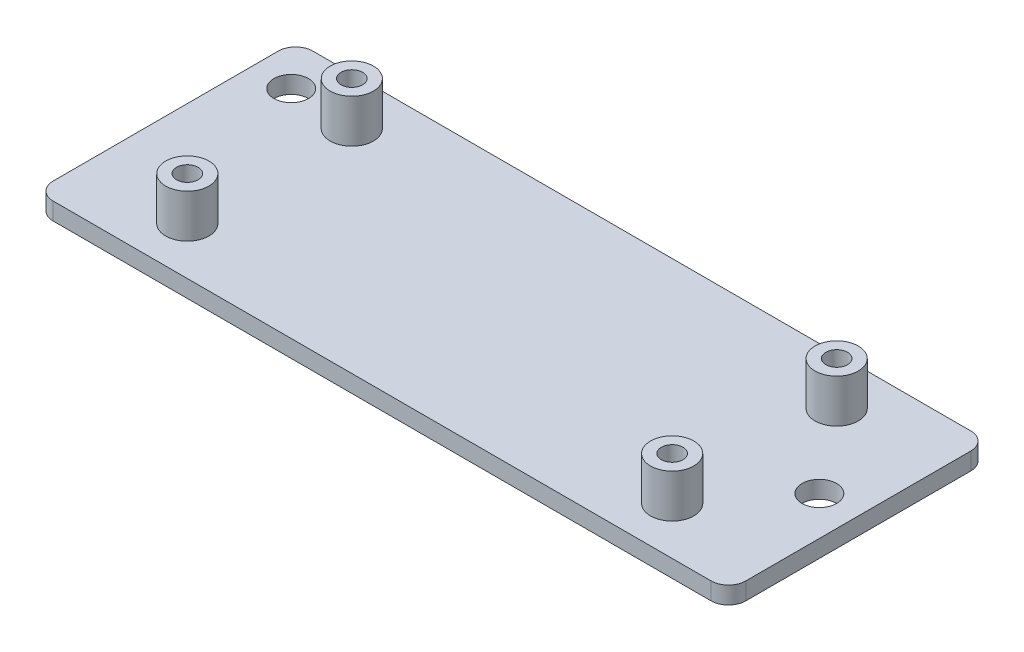
from build123d import *

# Parameters (mm, degrees)
SKETCH_1_W               = 80
SKETCH_1_H               = 30
EXTRUDE_1_DEPTH          = 2
SKETCH_2_R               = 2.5
EXTRUDE_2_DEPTH          = 5
CUT_EXTRUDE_1_DEPTH      = 86.726308681
CUT_EXTRUDE_1_DEPTH_BACK = 86.726308681
SKETCH_3_R               = 1.25
CUT_EXTRUDE_2_DEPTH      = 86.586213843
CUT_EXTRUDE_2_DEPTH_BACK = 86.586213843
SKETCH_4_R               = 2
FILLET_1_R               = 2
FILLET_2_R               = 2
FILLET_3_R               = 2
FILLET_4_R               = 2


with BuildPart() as part:
    # Эскиз1 → Бобышка-Вытянуть1 (new body)
    with BuildSketch(Plane(origin=(0, 0, 0), x_dir=(1, 0, 0), z_dir=(0, 1, 0))):
        with Locations((40, -15)):
            Rectangle(SKETCH_1_W, SKETCH_1_H)
    extrude(amount=EXTRUDE_1_DEPTH)

    # Эскиз2 → Бобышка-Вытянуть2 (add)
    with BuildSketch(Plane(origin=(0, 2, 0), x_dir=(1, 0, 0), z_dir=(0, 1, 0))):
        with Locations((12, -5.5)):
            Circle(SKETCH_2_R)
        with Locations((12, -24.5)):
            Circle(SKETCH_2_R)
        with Locations((68, -5.5)):
            Circle(SKETCH_2_R)
        with Locations((68, -24.5)):
            Circle(SKETCH_2_R)
    extrude(amount=EXTRUDE_2_DEPTH)

    # Эскиз3 → Вырез-Вытянуть1 (cut, two sides: drawn at the far end of the back side and taken through both)
    with BuildSketch(Plane(origin=(0, 7, 0), x_dir=(1, 0, 0), z_dir=(0, 1, 0)).offset(-CUT_EXTRUDE_1_DEPTH_BACK)):
        with Locations((12, -5.5)):
            Circle(SKETCH_3_R)
        with Locations((12, -24.5)):
            Circle(SKETCH_3_R)
        with Locations((68, -5.5)):
            Circle(SKETCH_3_R)
        with Locations((68, -24.5)):
            Circle(SKETCH_3_R)
    extrude(amount=CUT_EXTRUDE_1_DEPTH + CUT_EXTRUDE_1_DEPTH_BACK, mode=Mode.SUBTRACT)

    # Эскиз4 → Вырез-Вытянуть2 (cut, two sides: drawn at the far end of the back side and taken through both)
    with BuildSketch(Plane(origin=(0, 2, 0), x_dir=(1, 0, 0), z_dir=(0, 1, 0)).offset(-CUT_EXTRUDE_2_DEPTH_BACK)):
        with Locations((4.5, -5)):
            Circle(SKETCH_4_R)
        with Locations((75.5, -15)):
            Circle(SKETCH_4_R)
    extrude(amount=CUT_EXTRUDE_2_DEPTH + CUT_EXTRUDE_2_DEPTH_BACK, mode=Mode.SUBTRACT)

    # Скругление1
    fillet_1_edges = [part.edges().sort_by_distance(p)[0] for p in [
        (0, 1, 30),
    ]]
    fillet(fillet_1_edges, radius=FILLET_1_R)

    # Скругление2
    fillet_2_edges = [part.edges().sort_by_distance(p)[0] for p in [
        (0, 1, 0),
    ]]
    fillet(fillet_2_edges, radius=FILLET_2_R)

    # Скругление3
    fillet_3_edges = [part.edges().sort_by_distance(p)[0] for p in [
        (80, 1, 0),
    ]]
    fillet(fillet_3_edges, radius=FILLET_3_R)

    # Скругление4
    fillet_4_edges = [part.edges().sort_by_distance(p)[0] for p in [
        (80, 1, 30),
    ]]
    fillet(fillet_4_edges, radius=FILLET_4_R)


solid = part.part
